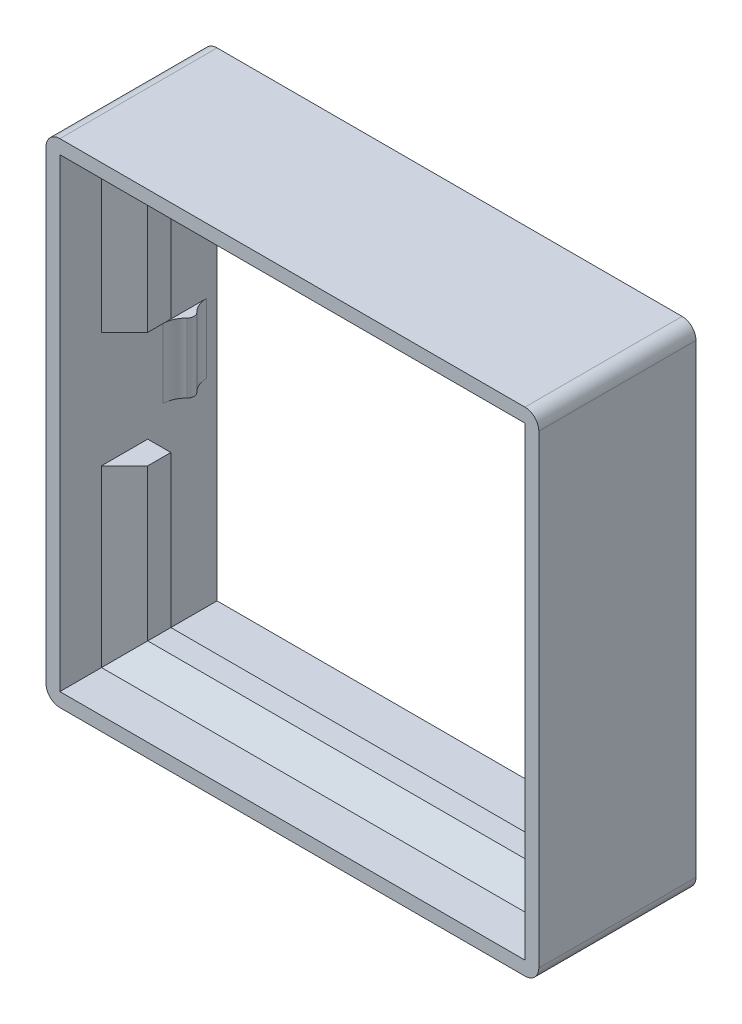
from build123d import *

# Parameters (mm, degrees)
SKETCH1_W            = 106.6
SKETCH1_H            = 106.6
SKETCH1_W_2          = 100.6
SKETCH1_H_2          = 100.6
BOSS_EXTRUDE1_DEPTH  = 200
SKETCH2_W            = 75
SKETCH2_H            = 10
CUT_EXTRUDE1_DEPTH   = 214.732964233
CIRPATTERN1_COUNT    = 2
CIRPATTERN1_ANGLE    = 90
FILLET1_R            = 3
BOSS_EXTRUDE2_DEPTH  = 5
SKETCH4_R            = 1.5
BOSS_EXTRUDE3_DEPTH  = 7.5
CUT_EXTRUDE3_DEPTH   = 10
FILLET2_R            = 5
FILLET2_OF_MIRROR3_R = 5
CHAMFER1_SIZE        = 5
SKETCH7_W            = 168.98996808
SKETCH7_H            = 119.087176344
TEST_PIECE_DEPTH     = 166


with BuildPart() as part:
    # Sketch1 → Boss-Extrude1 (new body)
    with BuildSketch(Plane(origin=(0, 0, 0), x_dir=(0, 1, 0), z_dir=(0, 0, 1))):
        Rectangle(SKETCH1_W, SKETCH1_H)
        Rectangle(SKETCH1_W_2, SKETCH1_H_2, mode=Mode.SUBTRACT)
    extrude(amount=BOSS_EXTRUDE1_DEPTH)

    # Sketch2 → Cut-Extrude1 (cut, symmetric)
    with BuildSketch(Plane.YZ):
        with Locations((0, 187.5)):
            Rectangle(SKETCH2_W, SKETCH2_H)
        with Locations((0, 172.5)):
            Rectangle(SKETCH2_W, SKETCH2_H)
        with Locations((0, 157.5)):
            Rectangle(SKETCH2_W, SKETCH2_H)
    cut_extrude1 = extrude(amount=CUT_EXTRUDE1_DEPTH, both=True, mode=Mode.SUBTRACT)

    # CirPattern1: Cut-Extrude1 ×2 about axis
    cirpattern1_axis = Axis((0, 0, 210), (0, 0, -1))
    for i in range(1, CIRPATTERN1_COUNT):
        add(cut_extrude1.rotate(cirpattern1_axis, i * CIRPATTERN1_ANGLE / (CIRPATTERN1_COUNT - 1)), mode=Mode.SUBTRACT)

    # Fillet1
    fillet1_edges = [part.edges().sort_by_distance(p)[0] for p in [
        (-53.3, -53.3, 100),
        (-53.3, 53.3, 100),
        (53.3, 53.3, 100),
        (53.3, -53.3, 100),
    ]]
    fillet(fillet1_edges, radius=FILLET1_R)

    # Sketch3 → Boss-Extrude2 (add)
    with BuildSketch(Plane(origin=(0, 0, 15), x_dir=(0, 1, 0), z_dir=(0, 0, 1))):
        Polygon((-50.3, -50.3), (-12.5, -50.3), (-12.5, -45.3), (-45.3, -45.3), (-45.3, 45.3), (-12.5, 45.3), (-12.5, 50.3), (-50.3, 50.3), align=None)
        Polygon((50.3, -50.3), (50.3, 50.3), (12.5, 50.3), (12.5, 45.3), (45.3, 45.3), (45.3, -45.3), (12.5, -45.3), (12.5, -50.3), align=None)
    extrude(amount=BOSS_EXTRUDE2_DEPTH)

    # Sketch4 → Boss-Extrude3 (add, symmetric)
    with BuildSketch(Plane(origin=(0, 0, 0), x_dir=(-1, 0, 0), z_dir=(0, 1, 0))):
        with Locations((49.8, 7)):
            Circle(SKETCH4_R)
    boss_extrude3 = extrude(amount=BOSS_EXTRUDE3_DEPTH, both=True)

    # Sketch6 → Cut-Extrude3 (cut, symmetric)
    with BuildSketch(Plane(origin=(0, 0, 0), x_dir=(-1, 0, 0), z_dir=(0, 1, 0))):
        Polygon((51.6, 13), (52, 13), (52.3, 12.7), (52.3, 1.3), (52, 1), (51.6, 1), (51.3, 1.3), (51.3, 12.7), align=None)
    cut_extrude3 = extrude(amount=CUT_EXTRUDE3_DEPTH, both=True, mode=Mode.SUBTRACT)

    # Fillet2
    fillet2_edges = [part.edges().sort_by_distance(p)[0] for p in [
        (-50.3, 0, 5.585786438),
        (-50.3, 0, 8.414213562),
    ]]
    fillet(fillet2_edges, radius=FILLET2_R)

    # Mirror3: Boss-Extrude3, Cut-Extrude3 across plane
    add(boss_extrude3.mirror(Plane(origin=(0, 0, 0), x_dir=(0, 0, 1), z_dir=(1, 0, 0))))
    add(cut_extrude3.mirror(Plane(origin=(0, 0, 0), x_dir=(0, 0, 1), z_dir=(1, 0, 0))), mode=Mode.SUBTRACT)

    # Fillet2 of Mirror3
    fillet2_of_mirror3_edges = [part.edges().sort_by_distance(p)[0] for p in [
        (50.3, 0, 5.585786438),
        (50.3, 0, 8.414213562),
    ]]
    fillet(fillet2_of_mirror3_edges, radius=FILLET2_OF_MIRROR3_R)

    # Chamfer1
    chamfer1_edges = [part.edges().sort_by_distance(p)[0] for p in [
        (50.3, 31.4, 20),
        (0, 50.3, 20),
        (-50.3, 31.4, 20),
        (-50.3, -31.4, 20),
        (0, -50.3, 20),
        (50.3, -31.4, 20),
    ]]
    chamfer(chamfer1_edges, length=CHAMFER1_SIZE - 0.0001)  # a hair under: the kernel refuses the full size

    # Sketch7 → test_piece (cut)
    with BuildSketch(Plane.XY.offset(200)):
        Rectangle(SKETCH7_W, SKETCH7_H)
    extrude(amount=-TEST_PIECE_DEPTH, mode=Mode.SUBTRACT)


solid = part.part
